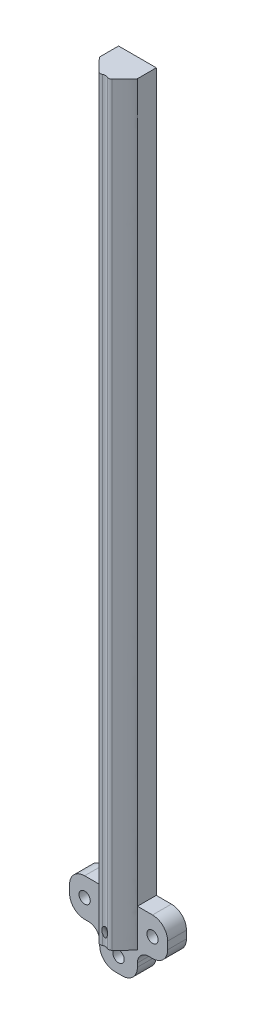
from build123d import *

# Parameters (mm, degrees)
SKETCH1_W           = 10
SKETCH1_H           = 10
BOSS_EXTRUDE1_DEPTH = 200
FILLET1_SIZE        = 5
SKETCH2_R           = 1.5
CUT_EXTRUDE1_DEPTH  = 201.499376667
FILLET2_R           = 1
SKETCH4_W           = 8
SKETCH4_H           = 10
BOSS_EXTRUDE2_DEPTH = 5
SKETCH5_W           = 10
SKETCH5_H           = 5
BOSS_EXTRUDE3_DEPTH = 8
FILLET3_R           = 4
FILLET4_R           = 3
SKETCH6_R           = 1.5
CUT_EXTRUDE3_DEPTH  = 201.870605219
SKETCH7_R           = 0.75
CUT_EXTRUDE4_DEPTH  = 8


with BuildPart() as part:
    # Sketch1 → Boss-Extrude1 (new body)
    with BuildSketch(Plane(origin=(0, 0, 0), x_dir=(1, 0, 0), z_dir=(0, 1, 0))):
        with Locations((5, -5)):
            Rectangle(SKETCH1_W, SKETCH1_H)
    extrude(amount=BOSS_EXTRUDE1_DEPTH)

    # Fillet1
    # a fillet whose section is not a circle: 5 mm, written as the material it takes off along each edge
    with BuildSketch(Plane(origin=(0, -12.5, 10), x_dir=(1, 0, 0), z_dir=(0, 1, 0)), Plane(origin=(10, -12.5, 10), x_dir=(0, 0, -1), z_dir=(0, 1, 0))) as fillet1_piece_1:
        with BuildLine():
            Bezier((FILLET1_SIZE, 0), (0, 0), (0, FILLET1_SIZE), weights=[1, 0.052631579, 1])
            Line((0, FILLET1_SIZE), (0, 0))
            Line((0, 0), (FILLET1_SIZE, 0))
        make_face()
    extrude(amount=225, mode=Mode.SUBTRACT)

    # Sketch2 → Cut-Extrude1 (cut, through all)
    with BuildSketch(Plane(origin=(0, 0, 0), x_dir=(-1, 0, 0), z_dir=(0, -1, 0))):
        with Locations((-5, -10)):
            Circle(SKETCH2_R)
    extrude(amount=-CUT_EXTRUDE1_DEPTH, mode=Mode.SUBTRACT)

    # Fillet2
    fillet2_edges = [part.edges().sort_by_distance(p)[0] for p in [
        (3.843309936, 100, 9.044977437),
        (6.156690064, 100, 9.044977437),
    ]]
    fillet(fillet2_edges, radius=FILLET2_R)

    # Sketch4 → Boss-Extrude2 (add)
    with BuildSketch(Plane(origin=(0, 0, 0), x_dir=(-1, 0, 0), z_dir=(0, 0, -1))):
        with Locations((4, 5)):
            Rectangle(SKETCH4_W, SKETCH4_H)
        with Locations((-14, 5)):
            Rectangle(SKETCH4_W, SKETCH4_H)
    extrude(amount=-BOSS_EXTRUDE2_DEPTH)

    # Sketch5 → Boss-Extrude3 (add)
    with BuildSketch(Plane(origin=(0, 0, 0), x_dir=(-1, 0, 0), z_dir=(0, -1, 0))):
        with Locations((-5, -2.5)):
            Rectangle(SKETCH5_W, SKETCH5_H)
    extrude(amount=BOSS_EXTRUDE3_DEPTH)

    # Fillet3
    fillet3_edges = [part.edges().sort_by_distance(p)[0] for p in [
        (18, 10, 2.5),
        (18, 0, 2.5),
        (10, -8, 2.5),
        (0, -8, 2.5),
        (-8, 10, 2.5),
        (-8, 0, 2.5),
    ]]
    fillet(fillet3_edges, radius=FILLET3_R)

    # Fillet4
    # the kernel refuses this fillet: 3 mm, written as the material it adds along each edge
    with BuildSketch(Plane(origin=(10, 0, 0), x_dir=(1, 0, 0), z_dir=(0, 0, 1)), Plane(origin=(0, 0, 5), x_dir=(-1, 0, 0), z_dir=(0, 0, -1))) as fillet4_piece_1:
        with BuildLine():
            CenterArc((FILLET4_R, -FILLET4_R), FILLET4_R, 90, 90)
            Line((0, -FILLET4_R), (0, 0))
            Line((0, 0), (FILLET4_R, 0))
        make_face()
    extrude(amount=5)

    # Sketch6 → Cut-Extrude3 (cut, through all)
    with BuildSketch(Plane.XY.offset(5)):
        with Locations((-4, 5)):
            Circle(SKETCH6_R)
        with Locations((14, 5)):
            Circle(SKETCH6_R)
        with Locations((5, -4)):
            Circle(SKETCH6_R)
    extrude(amount=-CUT_EXTRUDE3_DEPTH, mode=Mode.SUBTRACT)

    # Sketch7 → Cut-Extrude4 (cut)
    with BuildSketch(Plane(origin=(0, 2.349231552, 1.644949642), x_dir=(-1, 0, 0), z_dir=(0, 0.8191520442889949, 0.5735764363510416))):
        with Locations(Location((-5, 5.095760221, 0), (0, 0, 270))):
            Circle(SKETCH7_R)
    extrude(amount=CUT_EXTRUDE4_DEPTH, mode=Mode.SUBTRACT)


solid = part.part
